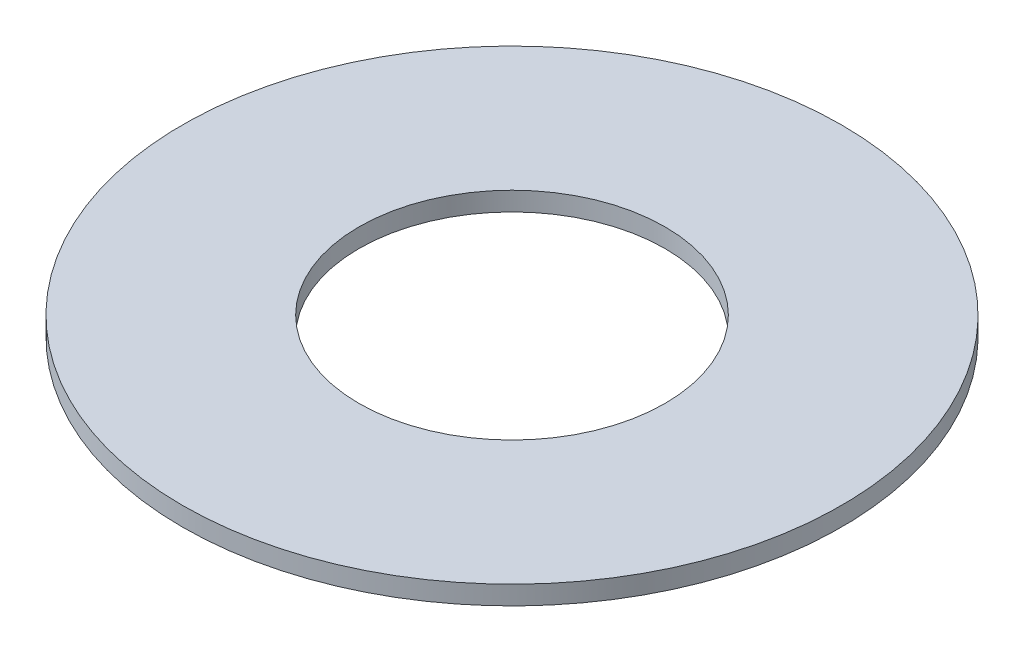
from build123d import *

# Parameters (mm, degrees)
SKETCH1_R           = 70
BOSS_EXTRUDE1_DEPTH = 4
SKETCH2_R           = 32.5
CUT_EXTRUDE1_DEPTH  = 100.075728612


with BuildPart() as part:
    # Sketch1 → Boss-Extrude1 (new body)
    with BuildSketch(Plane(origin=(0, 0, 0), x_dir=(1, 0, 0), z_dir=(0, 1, 0))):
        Circle(SKETCH1_R)
    extrude(amount=BOSS_EXTRUDE1_DEPTH)

    # Sketch2 → Cut-Extrude1 (cut, through all)
    with BuildSketch(Plane(origin=(0, 0, 0), x_dir=(1, 0, 0), z_dir=(0, 1, 0))):
        Circle(SKETCH2_R)
    extrude(amount=CUT_EXTRUDE1_DEPTH, mode=Mode.SUBTRACT)


solid = part.part
